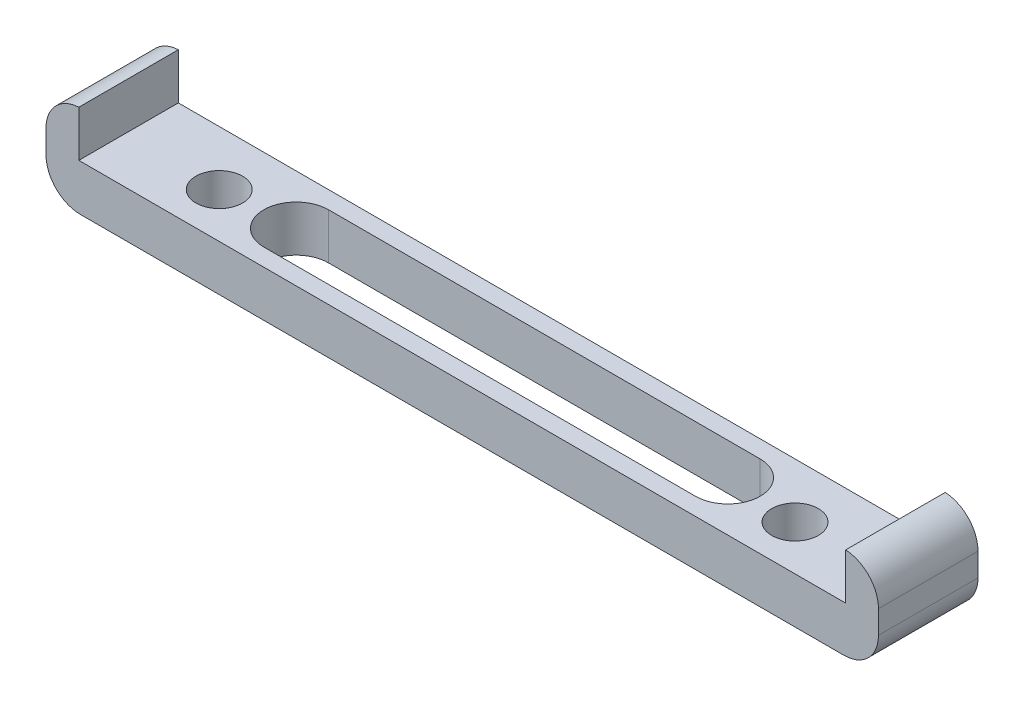
from build123d import *

# Parameters (mm, degrees)
SKETCH1_W                 = 66.29
SKETCH1_H                 = 100
BOSS_EXTRUDE1_DEPTH       = 41.59
SHELL2_T                  = -3
SHELL2_THICKNESS_2_FACE_W = 60.29
SHELL2_THICKNESS_2_FACE_H = 38.59
SHELL2_THICKNESS_2_DEPTH  = 1
SHELL2_THICKNESS_3_FACE_W = 60.29
SHELL2_THICKNESS_3_FACE_H = 38.59
SHELL2_THICKNESS_3_DEPTH  = 1
CUT_EXTRUDE1_DEPTH        = 125.59
FILLET1_R                 = 2
CUT_EXTRUDE2_REACH        = 128.981
SKETCH5_R                 = 5
SKETCH5_R_2               = 2.32
CUT_EXTRUDE3_START        = -3
SKETCH6_R                 = 23.17
CUT_EXTRUDE3_DEPTH        = 60.29
SKETCH7_R                 = 3.7
CUT_EXTRUDE4_DEPTH        = 1
BOSS_EXTRUDE2_DEPTH       = 10
SKETCH9_R                 = 1.5
CUT_EXTRUDE5_DEPTH        = 13
CUT_EXTRUDE6_START        = -6
SKETCH10_R                = 1.5
CUT_EXTRUDE6_DEPTH        = 6
CHAMFER1_SIZE             = 1
BOSS_EXTRUDE3_DEPTH       = 7
CHAMFER2_SIZE             = 1
SKETCH12_R                = 2.025
BOSS_EXTRUDE4_DEPTH       = 4
CHAMFER1_OF_MIRROR1_SIZE  = 1
CHAMFER2_OF_MIRROR1_SIZE  = 1
CUT_EXTRUDE7_REACH        = 130.572
SKETCH16_W                = 3
SKETCH16_H                = 0.2
CUT_EXTRUDE8_DEPTH        = 4.2
SKETCH17_W                = 9.044697424
SKETCH17_H                = 0.2
CUT_EXTRUDE9_DEPTH        = 66.29
SKETCH18_W                = 2.85
SKETCH18_H                = 8.644697424
BOSS_EXTRUDE5_DEPTH       = 4
FILLET2_R                 = 3
CUT_EXTRUDE10_DEPTH       = 10


with BuildPart() as part:
    # Sketch1 → Boss-Extrude1 (new body)
    with BuildSketch(Plane(origin=(0, 0, 0), x_dir=(1, 0, 0), z_dir=(0, 1, 0))):
        with Locations((33.145, 50)):
            Rectangle(SKETCH1_W, SKETCH1_H)
    extrude(amount=BOSS_EXTRUDE1_DEPTH)

    # Shell2
    shell2_openings = [part.faces().sort_by_distance(p)[0] for p in [
        (33.145, 41.59, -50),
    ]]
    offset(amount=SHELL2_T, openings=shell2_openings, kind=Kind.INTERSECTION)

    # Shell2 thickness 2 face (on inner face of the shell) → Shell2 thickness 2 (cut)
    with BuildSketch(Plane(origin=(33.145, 22.295, -3), x_dir=(1, 0, 0), z_dir=(0, 0, 1))):
        Rectangle(SHELL2_THICKNESS_2_FACE_W, SHELL2_THICKNESS_2_FACE_H)
    extrude(amount=SHELL2_THICKNESS_2_DEPTH, mode=Mode.SUBTRACT)

    # Shell2 thickness 3 face (on inner face of the shell) → Shell2 thickness 3 (cut)
    with BuildSketch(Plane(origin=(33.145, 22.295, -97), x_dir=(-1, 0, 0), z_dir=(0, 0, -1))):
        Rectangle(SHELL2_THICKNESS_3_FACE_W, SHELL2_THICKNESS_3_FACE_H)
    extrude(amount=SHELL2_THICKNESS_3_DEPTH, mode=Mode.SUBTRACT)

    # Sketch3 → Cut-Extrude1 (cut)
    with BuildSketch(Plane.XY):
        Polygon((54.395, 15), (11.895, 15), (11.895, 31.32), (8.815, 31.32), (8.815, 33.97), (7.755, 35.32), (7.145, 35.32), (7.145, 41.59), (59.145, 41.59), (57.145, 35.32), (56.535, 35.32), (55.475, 33.97), (55.475, 31.32), (52.395, 31.32), align=None)
    extrude(amount=-CUT_EXTRUDE1_DEPTH, mode=Mode.SUBTRACT)

    # Fillet1
    fillet1_edges = [part.edges().sort_by_distance(p)[0] for p in [
        (33.145, 0, -100),
        (66.29, 0, -50),
        (33.145, 0, 0),
        (0, 0, -50),
        (0, 20.795, -100),
        (66.29, 20.795, -100),
        (66.29, 20.795, 0),
        (0, 20.795, 0),
    ]]
    fillet(fillet1_edges, radius=FILLET1_R)

    # Cut-Extrude2: up to this face of the body (flat: up to its plane)
    cut_extrude2_end = Plane(part.part.faces().sort_by_distance((66.29, 21.795, -50))[0])
    # Sketch5 → Cut-Extrude2 (cut, up to the picked face)
    with BuildSketch(Plane.ZY, mode=Mode.PRIVATE) as cut_extrude2_sk1:
        with Locations((-72.87, 8)):
            Circle(SKETCH5_R)
    cut_extrude2_tool1 = split(extrude(cut_extrude2_sk1.sketch, amount=-CUT_EXTRUDE2_REACH, mode=Mode.PRIVATE), bisect_by=cut_extrude2_end, keep=Keep.BOTH, mode=Mode.PRIVATE)
    # Sketch5 → Cut-Extrude2 (cut, up to the picked face)
    with BuildSketch(Plane.ZY, mode=Mode.PRIVATE) as cut_extrude2_sk2:
        with Locations((-90.37, 15.93)):
            Circle(SKETCH5_R_2)
    cut_extrude2_tool2 = split(extrude(cut_extrude2_sk2.sketch, amount=-CUT_EXTRUDE2_REACH, mode=Mode.PRIVATE), bisect_by=cut_extrude2_end, keep=Keep.BOTH, mode=Mode.PRIVATE)
    # Sketch5 → Cut-Extrude2 (cut, up to the picked face)
    with BuildSketch(Plane.ZY, mode=Mode.PRIVATE) as cut_extrude2_sk3:
        with Locations((-55.37, 15.93)):
            Circle(SKETCH5_R_2)
    cut_extrude2_tool3 = split(extrude(cut_extrude2_sk3.sketch, amount=-CUT_EXTRUDE2_REACH, mode=Mode.PRIVATE), bisect_by=cut_extrude2_end, keep=Keep.BOTH, mode=Mode.PRIVATE)
    add(cut_extrude2_tool1.solids().sort_by(Axis((0, 8, -72.87), (1, 0, 0)))[0], mode=Mode.SUBTRACT)
    add(cut_extrude2_tool2.solids().sort_by(Axis((0, 15.93, -90.37), (1, 0, 0)))[0], mode=Mode.SUBTRACT)
    add(cut_extrude2_tool3.solids().sort_by(Axis((0, 15.93, -55.37), (1, 0, 0)))[0], mode=Mode.SUBTRACT)

    # Sketch6 → Cut-Extrude3 (cut)
    with BuildSketch(Plane.ZY.offset(CUT_EXTRUDE3_START)):
        with Locations((-72.87, 25.24)):
            Circle(SKETCH6_R)
    extrude(amount=-CUT_EXTRUDE3_DEPTH, mode=Mode.SUBTRACT)

    # Sketch7 → Cut-Extrude4 (cut)
    with BuildSketch(Plane.ZY):
        with Locations((-55.37, 15.93)):
            Circle(SKETCH7_R)
        with Locations((-90.37, 15.93)):
            Circle(SKETCH7_R)
    cut_extrude4 = extrude(amount=-CUT_EXTRUDE4_DEPTH, mode=Mode.SUBTRACT)

    # Sketch8 → Boss-Extrude2 (add)
    with BuildSketch(Plane(origin=(0, 3, 0), x_dir=(1, 0, 0), z_dir=(0, 1, 0))):
        Polygon((3, 18.5), (3, 2), (13, 2), (13, 18.5), (15.79, 18.5), (15.79, 21.25), (8, 21.25), (8, 18.5), align=None)
    boss_extrude2 = extrude(amount=BOSS_EXTRUDE2_DEPTH)

    # Sketch9 → Cut-Extrude5 (cut)
    with BuildSketch(Plane.ZY):
        with Locations((-8.24, 8)):
            Circle(SKETCH9_R)
    cut_extrude5 = extrude(amount=-CUT_EXTRUDE5_DEPTH, mode=Mode.SUBTRACT)

    # Sketch10 → Cut-Extrude6 (cut)
    # profile 1 of 2: a face of its own
    with BuildSketch(Plane(origin=(13, 0, 0), x_dir=(0, 0, -1), z_dir=(1, 0, 0)).offset(CUT_EXTRUDE6_START)):
        Polygon((6.74, 5.401923789), (9.74, 5.401923789), (11.24, 8), (9.74, 10.598076211), (6.74, 10.598076211), (5.24, 8), align=None)
        with Locations(Location((8.24, 8, 0), (0, 0, 180))):
            Circle(SKETCH10_R, mode=Mode.SUBTRACT)
    # profile 2 of 2: a face of its own
    with BuildSketch(Plane(origin=(13, 0, 0), x_dir=(0, 0, -1), z_dir=(1, 0, 0)).offset(CUT_EXTRUDE6_START)):
        with Locations(Location((8.24, 8, 0), (0, 0, 180))):
            Circle(SKETCH10_R)
    cut_extrude6 = extrude(amount=CUT_EXTRUDE6_DEPTH, mode=Mode.SUBTRACT)

    # Chamfer1
    chamfer1_edges = [part.edges().sort_by_distance(p)[0] for p in [
        (3, 8, -18.5),
        (13, 13, -10.25),
        (13, 8, -2),
        (14.395, 13, -18.5),
        (15.79, 13, -19.875),
        (8, 13, -19.875),
        (5.5, 13, -18.5),
        (3, 13, -10.25),
        (8, 13, -2),
        (11.895, 13, -21.25),
    ]]
    chamfer(chamfer1_edges, length=CHAMFER1_SIZE)

    # Sketch11 → Boss-Extrude3 (add)
    with BuildSketch(Plane(origin=(0, 3, 0), x_dir=(1, 0, 0), z_dir=(0, 1, 0))):
        Polygon((8, 52.25), (20.582035751, 52.25), (20.582035751, 55.357324548), (3, 55.357324548), (3, 52.25), align=None)
    boss_extrude3 = extrude(amount=BOSS_EXTRUDE3_DEPTH)

    # Chamfer2
    chamfer2_edges = [part.edges().sort_by_distance(p)[0] for p in [
        (20.582035751, 10, -53.803662274),
        (11.791017876, 10, -55.357324548),
        (11.791017876, 10, -52.25),
    ]]
    chamfer(chamfer2_edges, length=CHAMFER2_SIZE)

    # Sketch12 → Boss-Extrude4 (add)
    # profile 1 of 2: a face of its own
    with BuildSketch(Plane(origin=(0, 41.59, 0), x_dir=(1, 0, 0), z_dir=(0, 1, 0))):
        Polygon((8.145, 13.174697424), (33.145, 13.174697424), (33.145, 4.53), (8.145, 4.53), (-3, 4.53), (-3, 13.174697424), align=None)
        with Locations(Location((8.145, 8.43, 0), (0, 0, 270))):
            Circle(SKETCH12_R, mode=Mode.SUBTRACT)
    # profile 2 of 2: a face of its own
    with BuildSketch(Plane(origin=(0, 41.59, 0), x_dir=(1, 0, 0), z_dir=(0, 1, 0))):
        Polygon((8.145, 58.685302576), (-3, 58.685302576), (-3, 67.33), (8.145, 67.33), (33.145, 67.33), (33.145, 58.685302576), align=None)
        with Locations(Location((8.145, 63.43, 0), (0, 0, 270))):
            Circle(SKETCH12_R, mode=Mode.SUBTRACT)
    boss_extrude4 = extrude(amount=-BOSS_EXTRUDE4_DEPTH)

    # Mirror1: Cut-Extrude4, Boss-Extrude2, Cut-Extrude5, Cut-Extrude6, Boss-Extrude3, Boss-Extrude4 across plane
    add(cut_extrude4.mirror(Plane.ZY.offset(-33.145)), mode=Mode.SUBTRACT)
    add(boss_extrude2.mirror(Plane.ZY.offset(-33.145)))
    add(cut_extrude5.mirror(Plane.ZY.offset(-33.145)), mode=Mode.SUBTRACT)
    add(cut_extrude6.mirror(Plane.ZY.offset(-33.145)), mode=Mode.SUBTRACT)
    add(boss_extrude3.mirror(Plane.ZY.offset(-33.145)))
    add(boss_extrude4.mirror(Plane.ZY.offset(-33.145)))

    # Chamfer1 of Mirror1
    chamfer1_of_mirror1_edges = [part.edges().sort_by_distance(p)[0] for p in [
        (63.29, 8, -18.5),
        (53.29, 13, -10.25),
        (53.29, 8, -2),
        (51.895, 13, -18.5),
        (50.5, 13, -19.875),
        (58.29, 13, -19.875),
        (60.79, 13, -18.5),
        (63.29, 13, -10.25),
        (58.29, 13, -2),
        (54.395, 13, -21.25),
    ]]
    chamfer(chamfer1_of_mirror1_edges, length=CHAMFER1_OF_MIRROR1_SIZE)

    # Chamfer2 of Mirror1
    chamfer2_of_mirror1_edges = [part.edges().sort_by_distance(p)[0] for p in [
        (45.707964249, 10, -53.803662274),
        (54.498982124, 10, -55.357324548),
        (54.498982124, 10, -52.25),
    ]]
    chamfer(chamfer2_of_mirror1_edges, length=CHAMFER2_OF_MIRROR1_SIZE)

    # Cut-Extrude7: up to this face of the body (flat: up to its plane)
    cut_extrude7_end = Plane(part.part.faces().sort_by_distance((0, 21.922757181, -49.29907897))[0])
    # Sketch13 → Cut-Extrude7 (cut, up to the picked face)
    with BuildSketch(Plane(origin=(66.29, 0, 0), x_dir=(0, 0, -1), z_dir=(1, 0, 0)), mode=Mode.PRIVATE) as cut_extrude7_sk1:
        Polygon((15.839041752, 41.371414907), (26.360630861, 23.584658178), (47.025208595, 23.803243271), (57.168197218, 41.808585093), (46.646608109, 59.595341822), (25.982030375, 59.376756729), align=None)
    cut_extrude7_tool1 = split(extrude(cut_extrude7_sk1.sketch, amount=-CUT_EXTRUDE7_REACH, mode=Mode.PRIVATE), bisect_by=cut_extrude7_end, keep=Keep.BOTH, mode=Mode.PRIVATE)
    # Sketch13 → Cut-Extrude7 (cut, up to the picked face)
    with BuildSketch(Plane(origin=(66.29, 0, 0), x_dir=(0, 0, -1), z_dir=(1, 0, 0)), mode=Mode.PRIVATE) as cut_extrude7_sk2:
        Polygon((73.241690704, 41.59), (78.598611092, 32.311541717), (89.312451867, 32.311541717), (94.669372255, 41.59), (89.312451867, 50.868458283), (78.598611092, 50.868458283), align=None)
    cut_extrude7_tool2 = split(extrude(cut_extrude7_sk2.sketch, amount=-CUT_EXTRUDE7_REACH, mode=Mode.PRIVATE), bisect_by=cut_extrude7_end, keep=Keep.BOTH, mode=Mode.PRIVATE)
    add(cut_extrude7_tool1.solids().sort_by(Axis((66.29, 41.59, -36.503619), (-1, 0, 0)))[0], mode=Mode.SUBTRACT)
    add(cut_extrude7_tool2.solids().sort_by(Axis((66.29, 41.59, -83.955531), (-1, 0, 0)))[0], mode=Mode.SUBTRACT)

    # Sketch16 → Cut-Extrude8 (cut)
    with BuildSketch(Plane(origin=(0, 41.59, 0), x_dir=(1, 0, 0), z_dir=(0, 1, 0))):
        with Locations((1.5, 67.43)):
            Rectangle(SKETCH16_W, SKETCH16_H)
        with Locations((1.5, 58.585302576)):
            Rectangle(SKETCH16_W, SKETCH16_H)
        with Locations((1.5, 4.43)):
            Rectangle(SKETCH16_W, SKETCH16_H)
        with Locations((1.5, 13.274697424)):
            Rectangle(SKETCH16_W, SKETCH16_H)
        with Locations((64.79, 13.274697424)):
            Rectangle(SKETCH16_W, SKETCH16_H)
        with Locations((64.79, 4.43)):
            Rectangle(SKETCH16_W, SKETCH16_H)
        with Locations((64.79, 58.585302576)):
            Rectangle(SKETCH16_W, SKETCH16_H)
        with Locations((64.79, 67.43)):
            Rectangle(SKETCH16_W, SKETCH16_H)
    extrude(amount=-CUT_EXTRUDE8_DEPTH, mode=Mode.SUBTRACT)

    # Sketch17 → Cut-Extrude9 (cut)
    with BuildSketch(Plane.ZY):
        with Locations((-63.007651288, 37.49)):
            Rectangle(SKETCH17_W, SKETCH17_H)
        with Locations((-8.852348712, 37.49)):
            Rectangle(SKETCH17_W, SKETCH17_H)
    extrude(amount=-CUT_EXTRUDE9_DEPTH, mode=Mode.SUBTRACT)


with BuildPart() as cut_extrude9_piece_1:
    # of the separate pieces the step leaves, piece 1, a body of its own (cut_extrude9_pieces)
    add(part.part.solids().sort_by_distance((63.29, 9, -52.25))[0])


with BuildPart() as cut_extrude9_piece_2:
    # of the separate pieces the step leaves, piece 2, a body of its own (cut_extrude9_pieces)
    add(part.part.solids().sort_by_distance((69.29, 37.59, -58.685302576))[0])


with BuildPart() as cut_extrude9_piece_3:
    # of the separate pieces the step leaves, piece 3, a body of its own (cut_extrude9_pieces)
    add(part.part.solids().sort_by_distance((69.29, 37.59, -4.53))[0])

    # Sketch18 → Boss-Extrude5 (add)
    with BuildSketch(Plane(origin=(0, 41.59, 0), x_dir=(1, 0, 0), z_dir=(0, 1, 0))):
        with Locations((-1.575, 8.852348712)):
            Rectangle(SKETCH18_W, SKETCH18_H)
        with Locations((67.865, 8.852348712)):
            Rectangle(SKETCH18_W, SKETCH18_H)
    extrude(amount=BOSS_EXTRUDE5_DEPTH)

    # Fillet2
    # the kernel refuses this fillet: 3 mm, written as the material it takes off along each edge
    with BuildSketch(Plane(origin=(-3, 37.59, 2.97), x_dir=(1, 0, 0), z_dir=(0, 0, -1))) as fillet2_piece_1:
        with BuildLine():
            CenterArc((FILLET2_R, -FILLET2_R), FILLET2_R, 90, 90)
            Line((0, -FILLET2_R), (-FILLET2_R * 0.02, -FILLET2_R))
            Line((-FILLET2_R * 0.02, -FILLET2_R), (-FILLET2_R * 0.02, FILLET2_R * 0.02))
            Line((-FILLET2_R * 0.02, FILLET2_R * 0.02), (FILLET2_R, FILLET2_R * 0.02))
            Line((FILLET2_R, FILLET2_R * 0.02), (FILLET2_R, 0))
        make_face()
    extrude(amount=23.644697424, mode=Mode.SUBTRACT)
    with BuildSketch(Plane(origin=(69.29, 37.59, 2.97), x_dir=(-1, 0, 0), z_dir=(0, 0, -1))) as fillet2_piece_2:
        with BuildLine():
            CenterArc((FILLET2_R, FILLET2_R), FILLET2_R, 180, 90)
            Line((0, FILLET2_R), (-FILLET2_R * 0.02, FILLET2_R))
            Line((-FILLET2_R * 0.02, FILLET2_R), (-FILLET2_R * 0.02, -FILLET2_R * 0.02))
            Line((-FILLET2_R * 0.02, -FILLET2_R * 0.02), (FILLET2_R, -FILLET2_R * 0.02))
            Line((FILLET2_R, -FILLET2_R * 0.02), (FILLET2_R, 0))
        make_face()
    extrude(amount=23.644697424, mode=Mode.SUBTRACT)
    with BuildSketch(Plane(origin=(-3, 45.59, 2.960619133), x_dir=(1, 0, 0), z_dir=(0, 0, -1))) as fillet2_piece_3:
        with BuildLine():
            CenterArc((3, 2.996247653), FILLET2_R, 180, 87.134016017)
            Line((0, 2.996247653), (-0.06, 2.996247653))
            Line((-0.06, 2.996247653), (-0.06, 0))
            Line((-0.06, 0), (0, -0.06))
            ThreePointArc((0, -0.06), (1.425, -0.06), (2.847, -0.059924953))
            Line((2.847, -0.059924953), (2.85, 0))
        make_face()
    extrude(amount=23.62593569, mode=Mode.SUBTRACT)
    with BuildSketch(Plane(origin=(69.29, 45.59, 2.960619133), x_dir=(-1, 0, 0), z_dir=(0, 0, -1))) as fillet2_piece_4:
        with BuildLine():
            CenterArc((3, -2.996247653), FILLET2_R, 92.865983983, 87.134016017)
            Line((0, -2.996247653), (-0.06, -2.996247653))
            Line((-0.06, -2.996247653), (-0.06, 0))
            Line((-0.06, 0), (0, 0.06))
            ThreePointArc((0, 0.06), (1.425, 0.06), (2.847, 0.059924953))
            Line((2.847, 0.059924953), (2.85, 0))
        make_face()
    extrude(amount=23.62593569, mode=Mode.SUBTRACT)

    # Sketch19 → Cut-Extrude10 (cut)
    with BuildSketch(Plane(origin=(0, 41.59, 0), x_dir=(1, 0, 0), z_dir=(0, 1, 0))):
        with BuildLine():
            Line((14.402805243, 11.660524623), (51.887194757, 11.660524623))
            ThreePointArc((51.887194757, 11.660524623), (54.695370668, 8.852348712), (51.887194757, 6.044172801))
            Line((51.887194757, 6.044172801), (14.402805243, 6.044172801))
            ThreePointArc((14.402805243, 6.044172801), (11.594629332, 8.852348712), (14.402805243, 11.660524623))
        make_face()
    extrude(amount=-CUT_EXTRUDE10_DEPTH, mode=Mode.SUBTRACT)


solid = cut_extrude9_piece_3.part
